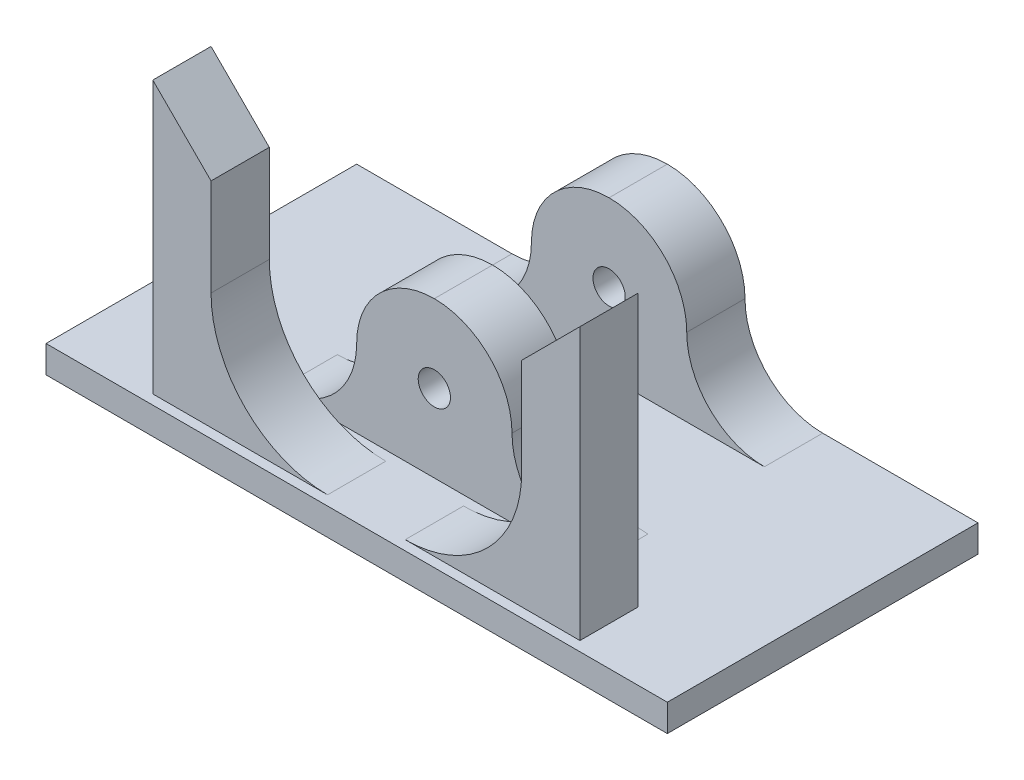
from build123d import *

# Parameters (mm, degrees)
SKETCH1_W           = 160
SKETCH1_H           = 60
BOSS_EXTRUDE1_DEPTH = 7
SKETCH2_W           = 40
SKETCH2_H           = 60
BOSS_EXTRUDE2_DEPTH = 40
FILLET1_R           = 20
SKETCH3_W           = 30
SKETCH3_H           = 40
CUT_EXTRUDE1_DEPTH  = 40
SKETCH4_R           = 4.15
CUT_EXTRUDE2_DEPTH  = 178.225844616
FILLET2_R           = 20
SKETCH5_W           = 160
SKETCH5_H           = 7
BOSS_EXTRUDE3_DEPTH = 20
SKETCH6_W           = 15
SKETCH6_H           = 15
BOSS_EXTRUDE4_DEPTH = 70
FILLET3_R           = 30
CHAMFER1_SIZE       = 15


with BuildPart() as part:
    # Sketch1 → Boss-Extrude1 (new body)
    with BuildSketch(Plane(origin=(0, 0, 0), x_dir=(1, 0, 0), z_dir=(0, 1, 0))):
        with Locations((-80, 30)):
            Rectangle(SKETCH1_W, SKETCH1_H)
    extrude(amount=BOSS_EXTRUDE1_DEPTH)

    # Sketch2 → Boss-Extrude2 (add)
    with BuildSketch(Plane(origin=(0, 7, 0), x_dir=(1, 0, 0), z_dir=(0, 1, 0))):
        with Locations((-80, 30)):
            Rectangle(SKETCH2_W, SKETCH2_H)
    extrude(amount=BOSS_EXTRUDE2_DEPTH)

    # Fillet1
    fillet1_edges = [part.edges().sort_by_distance(p)[0] for p in [
        (-60, 47, -30),
        (-100, 47, -30),
    ]]
    fillet(fillet1_edges, radius=FILLET1_R - 0.0001)  # a hair under: the kernel refuses the full size

    # Sketch3 → Cut-Extrude1 (cut)
    with BuildSketch(Plane(origin=(-60, 0, 0), x_dir=(0, 0, -1), z_dir=(1, 0, 0))):
        with Locations((30, 27)):
            Rectangle(SKETCH3_W, SKETCH3_H)
    extrude(amount=-CUT_EXTRUDE1_DEPTH, mode=Mode.SUBTRACT)

    # Sketch4 → Cut-Extrude2 (cut, through all)
    with BuildSketch(Plane.XY):
        with Locations((-80, 27)):
            Circle(SKETCH4_R)
    extrude(amount=-CUT_EXTRUDE2_DEPTH, mode=Mode.SUBTRACT)

    # Fillet2
    fillet2_edges = [part.edges().sort_by_distance(p)[0] for p in [
        (-100, 7, -7.5),
        (-100, 7, -52.5),
        (-60, 7, -7.5),
        (-60, 7, -52.5),
    ]]
    fillet(fillet2_edges, radius=FILLET2_R)

    # Sketch5 → Boss-Extrude3 (add)
    with BuildSketch(Plane.XY):
        with Locations((-80, 3.5)):
            Rectangle(SKETCH5_W, SKETCH5_H)
    extrude(amount=BOSS_EXTRUDE3_DEPTH)

    # Sketch6 → Boss-Extrude4 (add)
    with BuildSketch(Plane(origin=(0, 7, 0), x_dir=(1, 0, 0), z_dir=(0, 1, 0))):
        with Locations((-127.5, -10)):
            Rectangle(SKETCH6_W, SKETCH6_H)
        with Locations((-32.5, -10)):
            Rectangle(SKETCH6_W, SKETCH6_H)
    extrude(amount=BOSS_EXTRUDE4_DEPTH)

    # Fillet3
    fillet3_edges = [part.edges().sort_by_distance(p)[0] for p in [
        (-120, 7, 10),
        (-40, 7, 10),
    ]]
    fillet(fillet3_edges, radius=FILLET3_R)

    # Chamfer1
    chamfer1_edges = [part.edges().sort_by_distance(p)[0] for p in [
        (-40, 77, 10),
        (-120, 77, 10),
    ]]
    chamfer(chamfer1_edges, length=CHAMFER1_SIZE - 0.0001)  # a hair under: the kernel refuses the full size


solid = part.part
